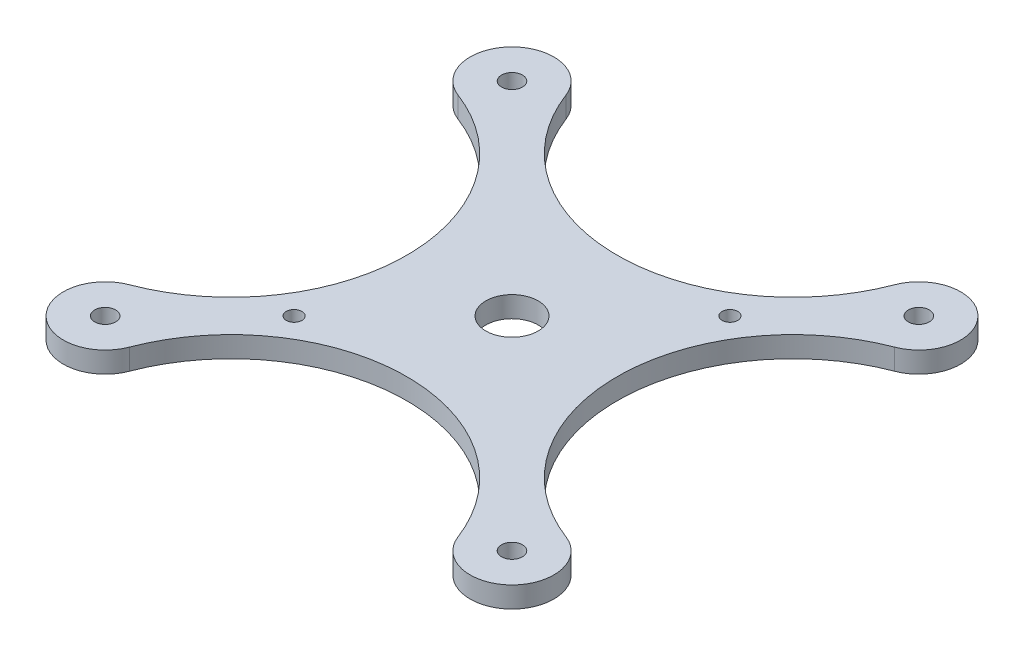
from build123d import *

# Parameters (mm, degrees)
SKETCH1_R           = 2
SKETCH1_R_2         = 5
SKETCH1_R_3         = 1.5
BOSS_EXTRUDE1_DEPTH = 4


with BuildPart() as part:
    # Sketch1 → Boss-Extrude1 (new body)
    with BuildSketch(Plane(origin=(0, 0, 0), x_dir=(1, 0, 0), z_dir=(0, 1, 0))):
        with BuildLine():
            ThreePointArc((-31.416051551, 41.741670191), (0, 20.1), (31.416051551, 41.741670191))
            ThreePointArc((31.416051551, 41.741670191), (44.547727215, 44.547727215), (41.741670191, 31.416051551))
            ThreePointArc((41.741670191, 31.416051551), (20.1, 0), (41.741670191, -31.416051551))
            ThreePointArc((41.741670191, -31.416051551), (44.547727215, -44.547727215), (31.416051551, -41.741670191))
            ThreePointArc((31.416051551, -41.741670191), (0, -20.1), (-31.416051551, -41.741670191))
            ThreePointArc((-31.416051551, -41.741670191), (-44.547727215, -44.547727215), (-41.741670191, -31.416051551))
            ThreePointArc((-41.741670191, -31.416051551), (-20.1, 0), (-41.741670191, 31.416051551))
            ThreePointArc((-41.741670191, 31.416051551), (-44.547727215, 44.547727215), (-31.416051551, 41.741670191))
        make_face()
        with Locations((-38.890872965, 38.890872965)):
            Circle(SKETCH1_R, mode=Mode.SUBTRACT)
        with Locations((38.890872965, 38.890872965)):
            Circle(SKETCH1_R, mode=Mode.SUBTRACT)
        with Locations((38.890872965, -38.890872965)):
            Circle(SKETCH1_R, mode=Mode.SUBTRACT)
        with Locations((-38.890872965, -38.890872965)):
            Circle(SKETCH1_R, mode=Mode.SUBTRACT)
        Circle(SKETCH1_R_2, mode=Mode.SUBTRACT)
        with Locations((20.831365774, 20.831365774)):
            Circle(SKETCH1_R_3, mode=Mode.SUBTRACT)
        with Locations((-20.831365774, -20.831365774)):
            Circle(SKETCH1_R_3, mode=Mode.SUBTRACT)
    extrude(amount=BOSS_EXTRUDE1_DEPTH)


solid = part.part
